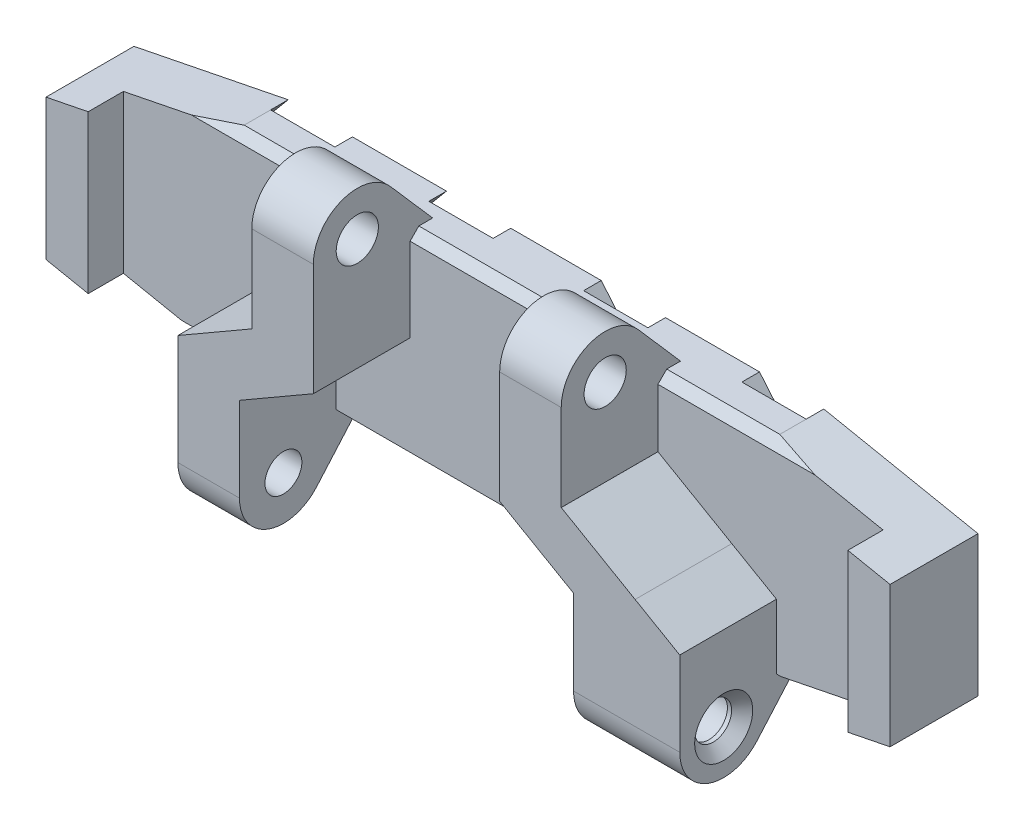
from build123d import *
from OCP.BRepAlgoAPI import BRepAlgoAPI_Cut
from OCP.TopTools import TopTools_ListOfShape

# Parameters (mm, degrees)
BOSS_EXTRUDE1_DEPTH    = 2.99974
BOSS_EXTRUDE2_DEPTH    = 5.00126
BOSS_EXTRUDE3_DEPTH    = 3.50012
CIRPATTERN1_COUNT      = 2
BOSS_EXTRUDE4_REACH    = 30.871
CUT_EXTRUDE1_DEPTH     = 5.5
CUT_EXTRUDE2_DEPTH     = 1.00076
MIRROR2_START          = -12.999258093
MIRROR2_DEPTH          = 7.70128
MIRROR2_START_2        = 2.99974
MIRROR2_2_DEPTH        = 5.5
MIRROR2_3_OUTLINE_W    = 4.20116
MIRROR2_3_OUTLINE_H    = 4.60831964
MIRROR2_3_OUTLINE_H_2  = 4.995876312
MIRROR2_3_DEPTH        = 2.99974
MIRROR2_4_DEPTH        = 5.5
SKETCH9_R              = 1.05
OUTSIDE_HOLES_DEPTH    = 41.329539227
SKETCH10_R             = 1.2
INSIDE_HOLES_DEPTH     = 37.513584997
BOSS_EXTRUDE5_START    = 2.54
SKETCH12_R             = 1.05
BOSS_EXTRUDE5_DEPTH    = 2.54
HEAD_POCKET_DEPTH      = 1.7
HEAD_POCKET_DEPTH_BACK = 0.7
SKETCH11_R             = 1.45
CHAMFER1_SIZE          = 0.6
CORNER_CUT_DEPTH       = 5.5
CHAMFER2_SIZE          = 0.5


with BuildPart() as part:
    # Sketch1 → Boss-Extrude1 (new body)
    with BuildSketch(Plane(origin=(0, 0, 0), x_dir=(-1, 0, 0), z_dir=(0, 0, -1))):
        Polygon((23.999998093, 0.250000321), (23.999998093, 8.25), (15.229382515, 10.004123688), (-15.229382515, 10.004123688), (-23.999998093, 8.25), (-23.999998093, 0.25), (-15.791597366, -1.39168036), (15.791597366, -1.39168036), align=None)
    extrude(amount=-BOSS_EXTRUDE1_DEPTH)

    # Sketch2 → Boss-Extrude2 (add)
    with BuildSketch(Plane(origin=(0, 0, 0), x_dir=(-1, 0, 0), z_dir=(0, 0, -1))):
        Polygon((21.599998474, -0.230000138), (21.599998474, 8.729999542), (23.999998093, 8.25), (23.999998093, 0.249999762), align=None)
        Polygon((-23.999998093, 0.249999762), (-23.999998093, 8.25), (-21.599998474, 8.729999542), (-21.599998474, -0.230000138), align=None)
    extrude(amount=-BOSS_EXTRUDE2_DEPTH)

    # Sketch3 → Boss-Extrude3 (add)
    with BuildSketch(Plane(origin=(12.999258093, 0, 0), x_dir=(0, 0, -1), z_dir=(1, 0, 0))):
        with BuildLine():
            Line((-2.99974, 4.117571831), (-8.49974, 4.117571354))
            Line((-8.49974, 4.117571354), (-8.49974, -2.500000222))
            ThreePointArc((-8.49974, -2.500000222), (-6.87834524, -4.840080872), (-4.117836275, -4.144028668))
            Line((-4.117836275, -4.144028668), (-1.714206095, -1.39168036))
            Line((-1.714206095, -1.39168036), (-2.99974, -1.39168036))
            Line((-2.99974, -1.39168036), (-2.99974, 4.117571831))
        make_face()
    boss_extrude3 = extrude(amount=-BOSS_EXTRUDE3_DEPTH)

    # CirPattern1: Boss-Extrude3 ×2 about axis
    cirpattern1_axis = Axis((9.148618093, 4.306221664, 0), (0, 0, 1))
    for i in range(1, CIRPATTERN1_COUNT):
        add(boss_extrude3.rotate(cirpattern1_axis, i * 360 / CIRPATTERN1_COUNT))

    # Sketch4 → Boss-Extrude4 (add, up to next)
    with BuildSketch(Plane.XY.offset(8.49974), mode=Mode.PRIVATE) as boss_extrude4_sk1:
        Polygon((8.799999237, 6.184122562), (12.999999024, 3.759251555), (9.499999024, 2.315876444), (5.299999237, 4.740747452), align=None)
    boss_extrude4_tool1 = extrude(boss_extrude4_sk1.sketch, amount=-BOSS_EXTRUDE4_REACH, mode=Mode.PRIVATE) - part.part
    add(boss_extrude4_tool1.solids().sort_by_distance((9.149999, 4.25, 8.49974))[0])


with BuildPart() as cut_extrude1_tool:
    # Sketch5 → Cut-Extrude1 (new body)
    with BuildSketch(Plane.XY.offset(8.49974)):
        Polygon((12.999999024, 3.759251555), (12.999258093, 4.117571354), (12.379370927, 4.117571354), align=None)
        Polygon((5.725868057, 4.494871974), (5.297978093, 4.494871974), (5.297978093, 4.74191436), align=None)
    extrude(amount=-CUT_EXTRUDE1_DEPTH)


with BuildPart() as part_1:
    add(part.part)

    # Cut-Extrude1: cut by cut_extrude1_tool, with a tolerance
    cut_extrude1_stock = TopTools_ListOfShape()
    cut_extrude1_stock.Append(part_1.part.wrapped)
    cut_extrude1_tools = TopTools_ListOfShape()
    cut_extrude1_tools.Append(cut_extrude1_tool.part.wrapped)
    cut_extrude1_cut = BRepAlgoAPI_Cut()
    cut_extrude1_cut.SetArguments(cut_extrude1_stock)
    cut_extrude1_cut.SetTools(cut_extrude1_tools)
    cut_extrude1_cut.SetFuzzyValue(0.00001)
    cut_extrude1_cut.Build()
    add(Compound.cast(cut_extrude1_cut.Shape()).solids(), mode=Mode.REPLACE)


with BuildPart() as cut_extrude2_tool:
    # Sketch6 → Cut-Extrude2 (new body)
    with BuildSketch(Plane(origin=(0, 0, 0), x_dir=(-1, 0, 0), z_dir=(0, 0, -1))):
        Polygon((20.368379593, -0.476323605), (11.367927551, 10.25), (15.229382515, 10.004123688), (23.498262405, 0.149653077), align=None)
        Polygon((2.36792779, 10.25), (12.437123299, -1.75), (15.791597366, -1.39168036), (6.023067951, 10.25), align=None)
        Polygon((0, 6.702231407), (7.092263699, -1.75), (3.437123299, -1.75), (0, 2.346204281), (-3.437123299, -1.75), (-7.092263699, -1.75), align=None)
        Polygon((-15.791597366, -1.39168036), (-6.023067951, 10.25), (-2.36792779, 10.25), (-12.437123299, -1.75), align=None)
        Polygon((-11.367927551, 10.25), (-20.368379593, -0.476323605), (-23.498262405, 0.149653077), (-15.229382515, 10.004123688), align=None)
    extrude(amount=-CUT_EXTRUDE2_DEPTH)


with BuildPart() as part_2:
    add(part_1.part)

    # Cut-Extrude2: cut by cut_extrude2_tool, with a tolerance
    cut_extrude2_stock = TopTools_ListOfShape()
    cut_extrude2_stock.Append(part_2.part.wrapped)
    cut_extrude2_tools = TopTools_ListOfShape()
    cut_extrude2_tools.Append(cut_extrude2_tool.part.wrapped)
    cut_extrude2_cut = BRepAlgoAPI_Cut()
    cut_extrude2_cut.SetArguments(cut_extrude2_stock)
    cut_extrude2_cut.SetTools(cut_extrude2_tools)
    cut_extrude2_cut.SetFuzzyValue(0.00001)
    cut_extrude2_cut.Build()
    add(Compound.cast(cut_extrude2_cut.Shape()).solids(), mode=Mode.REPLACE)

    # Mirror2: read off the stored shape, not the designer's step
    # Mirror2 outline → Mirror2 (add)
    with BuildSketch(Plane.YZ.offset(MIRROR2_START)):
        with BuildLine():
            Line((11.11244355, 8.49974), (-2.500000222, 8.49974))
            ThreePointArc((-2.500000222, 8.49974), (-4.840080872, 6.87834524), (-4.144028668, 4.117836275))
            Line((-4.144028668, 4.117836275), (-1.39168036, 1.714206095))
            Line((-1.39168036, 1.714206095), (-1.39168036, 2.99974))
            Line((-1.39168036, 2.99974), (10.004123688, 2.99974))
            Line((10.004123688, 2.99974), (10.004123688, 1.714206095))
            Line((10.004123688, 1.714206095), (12.756471996, 4.117836275))
            ThreePointArc((12.756471996, 4.117836275), (13.4525242, 6.87834524), (11.11244355, 8.49974))
        make_face()
    extrude(amount=MIRROR2_DEPTH)

    # Mirror2 2 outline → Mirror2 2 (cut)
    with BuildSketch(Plane.XY.offset(MIRROR2_START_2)):
        Polygon((-5.297978093, 4.74191436), (-9.499138093, 2.316373503), (-9.499138093, -6), (-5.297978093, -6), align=None)
        Polygon((-12.999258093, 3.759679332), (-8.799999237, 6.184122562), (-8.798098093, 6.183338544), (-8.798098093, 15), (-12.999258093, 15), align=None)
    extrude(amount=MIRROR2_2_DEPTH, mode=Mode.SUBTRACT)

    # Mirror2 3 outline → Mirror2 3 (cut)
    with BuildSketch(Plane.XY):
        with Locations((-7.398558093, -3.69584018)):
            Rectangle(MIRROR2_3_OUTLINE_W, MIRROR2_3_OUTLINE_H)
        with Locations((-10.898678093, 12.502061844)):
            Rectangle(MIRROR2_3_OUTLINE_W, MIRROR2_3_OUTLINE_H_2)
    extrude(amount=MIRROR2_3_DEPTH, mode=Mode.SUBTRACT)

    # Mirror2 4 outline → Mirror2 4 (add)
    with BuildSketch(Plane.XY.offset(MIRROR2_START_2)):
        Polygon((-12.999999024, 3.759251555), (-12.999258093, 3.758946), (-12.999258093, 3.759679332), align=None)
    extrude(amount=MIRROR2_4_DEPTH)

    # Sketch9 → Outside_Holes (cut, through all)
    with BuildSketch(Plane(origin=(12.999258093, 0, 0), x_dir=(0, 0, -1), z_dir=(1, 0, 0))):
        with Locations((-6.00038, -2.500000222)):
            Circle(SKETCH9_R)
    extrude(amount=-OUTSIDE_HOLES_DEPTH, mode=Mode.SUBTRACT)

    # Sketch10 → Inside_Holes (cut, through all)
    with BuildSketch(Plane(origin=(8.798098093, 0, 0), x_dir=(0, 0, -1), z_dir=(1, 0, 0))):
        with Locations((-6.00038, 11.11244355)):
            Circle(SKETCH10_R)
    extrude(amount=-INSIDE_HOLES_DEPTH, mode=Mode.SUBTRACT)

    # Sketch12 → Boss-Extrude5 (add)
    with BuildSketch(Plane(origin=(12.999258093, 0, 0), x_dir=(0, 0, -1), z_dir=(1, 0, 0)).offset(BOSS_EXTRUDE5_START)):
        with BuildLine():
            Line((-2.99974, 3.758946), (-8.49974, 3.758946))
            Line((-8.49974, 3.758946), (-8.49974, -2.500000222))
            ThreePointArc((-8.49974, -2.500000222), (-6.87834524, -4.840080872), (-4.117836275, -4.144028668))
            Line((-4.117836275, -4.144028668), (-1.714206095, -1.39168036))
            Line((-1.714206095, -1.39168036), (-2.99974, -1.39168036))
            Line((-2.99974, -1.39168036), (-2.99974, 3.758946))
        make_face()
        with Locations((-6.00038, -2.500000222)):
            Circle(SKETCH12_R, mode=Mode.SUBTRACT)
    extrude(amount=-BOSS_EXTRUDE5_DEPTH)

    # Sketch11 → Head_Pocket (cut, two sides: drawn at the far end of the back side and taken through both)
    with BuildSketch(Plane(origin=(12.999258093, 0, 0), x_dir=(0, 0, -1), z_dir=(1, 0, 0)).offset(-HEAD_POCKET_DEPTH_BACK)):
        with Locations((-6.00038, -2.500000222)):
            Circle(SKETCH11_R)
    extrude(amount=HEAD_POCKET_DEPTH + HEAD_POCKET_DEPTH_BACK, mode=Mode.SUBTRACT)

    # Chamfer1
    chamfer1_edges = [part_2.edges().sort_by_distance(p)[0] for p in [
        (15.539258093, -2.500000222, 7.05038),
    ]]
    chamfer(chamfer1_edges, length=CHAMFER1_SIZE)

    # Sketch13 → Corner_Cut (cut)
    with BuildSketch(Plane.XY.offset(8.49974)):
        Polygon((15.539258093, 3.758946), (15.539258093, 2.292476317), (12.999258093, 3.758946), align=None)
    extrude(amount=-CORNER_CUT_DEPTH, mode=Mode.SUBTRACT)

    # Chamfer2
    chamfer2_edges = [part_2.edges().sort_by_distance(p)[0] for p in [
        (-10.898678093, 10.004123688, 2.99974),
        (-14.39542773, -1.39168036, 2.99974),
        (0, 10.004123688, 2.99974),
        (2.10058, -1.39168036, 2.99974),
        (12.013740304, 10.004123688, 2.99974),
    ]]
    chamfer(chamfer2_edges, length=CHAMFER2_SIZE)


solid = part_2.part
